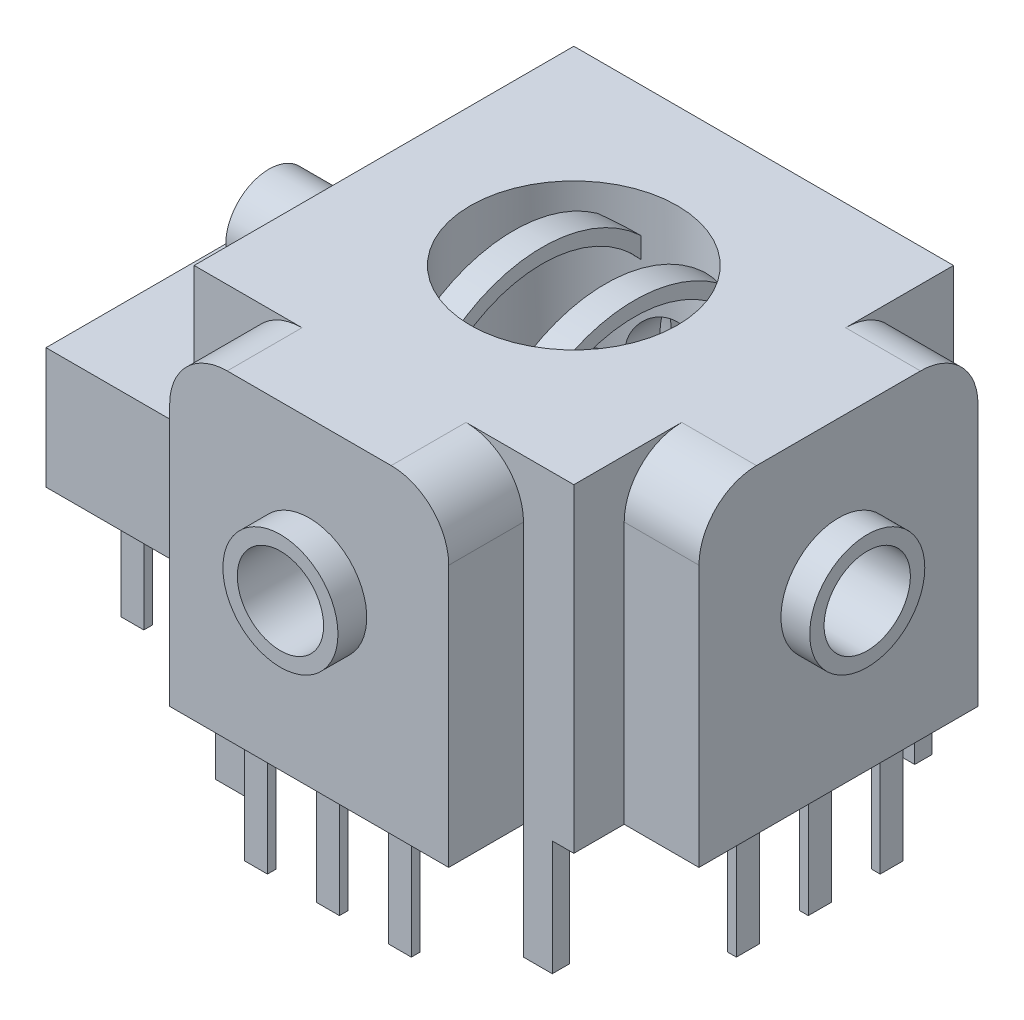
from build123d import *

# Parameters (mm, degrees)
SKETCH_1_W          = 13.2
SKETCH_1_H          = 13.2
SKETCH_1_W_2        = 2.6
SKETCH_1_H_2        = 9.7
SKETCH_1_W_3        = 9.7
SKETCH_1_H_3        = 2.6
EXTRUDE_1_DEPTH     = 11.1
SKETCH_1_7_W        = 7
SKETCH_1_7_H        = 9.5
EXTRUDE_2_DEPTH     = 4.2
SKETCH_1_8_R        = 1.75
EXTRUDE_3_DEPTH     = 5.2
SKETCH_2_R          = 1.5
EXTRUDE_4_DEPTH     = 4
SKETCH_1_9_W        = 1.4
SKETCH_1_9_H        = 1
EXTRUDE_5_DEPTH     = 1.8
SKETCH_3_R          = 2
SKETCH_3_R_2        = 1.5
EXTRUDE_6_DEPTH     = 1
CUT_EXTRUDE_START   = -10
SKETCH_3_3_R        = 1.5
CUT_EXTRUDE_1_DEPTH = 10
SKETCH_4_R          = 2
SKETCH_4_R_2        = 1.5
EXTRUDE_7_DEPTH     = 1
SKETCH_4_3_R        = 1.5
CUT_EXTRUDE_2_DEPTH = 25.298353854
CUT_EXTRUDE_START_2 = 11.1
SKETCH_1_10_R       = 3.6
CUT_EXTRUDE_3_DEPTH = 5
SKETCH_5_W          = 0.8
SKETCH_5_H          = 0.3
SKETCH_5_W_2        = 0.3
SKETCH_5_H_2        = 0.8
SKETCH_5_W_3        = 1
SKETCH_5_H_3        = 0.6
EXTRUDE_8_DEPTH     = 4
FILLET_1_R          = 2
EXTRUDE_START       = -8.1
EXTRUDE_1_2_DEPTH   = 1
EXTRUDE_START_2     = -11.3
EXTRUDE_2_2_DEPTH   = 1


# Read off the part's stored shape, not the designer's step: 拉伸-薄壁1, 拉伸-薄壁2
with BuildPart() as part:
    # 草图1 → Extrude 1 (new body)
    with BuildSketch(Plane(origin=(0, 0, 0), x_dir=(1, 0, 0), z_dir=(0, 1, 0))):
        Rectangle(SKETCH_1_W, SKETCH_1_H)
        with Locations((7.9, 0)):
            Rectangle(SKETCH_1_W_2, SKETCH_1_H_2)
        with Locations((0, -7.9)):
            Rectangle(SKETCH_1_W_3, SKETCH_1_H_3)
    extrude(amount=EXTRUDE_1_DEPTH)

    # 草图1<7> → Extrude 2 (add)
    with BuildSketch(Plane(origin=(0, 0, 0), x_dir=(1, 0, 0), z_dir=(0, 1, 0))):
        with Locations((-10.1, 0)):
            Rectangle(SKETCH_1_7_W, SKETCH_1_7_H)
    extrude(amount=EXTRUDE_2_DEPTH)

    # 草图1<8> → 凸台-拉伸3 (add)
    with BuildSketch(Plane(origin=(0, 0, 0), x_dir=(1, 0, 0), z_dir=(0, 1, 0))):
        with Locations(Location((-10.1, 0, 0), (0, 0, 270))):
            Circle(SKETCH_1_8_R)
    extrude(amount=EXTRUDE_3_DEPTH)

    # 草图2 → 凸台-拉伸4 (add)
    with BuildSketch(Plane.ZY.offset(6.6)):
        with Locations(Location((0, 7.2, 0), (0, 0, 180))):
            Circle(SKETCH_2_R)
    extrude(amount=EXTRUDE_4_DEPTH)

    # 草图1<9> → 凸台-拉伸5 (add)
    with BuildSketch(Plane(origin=(0, 0, 0), x_dir=(1, 0, 0), z_dir=(0, 1, 0))):
        with Locations((-4.15, 7.1)):
            Rectangle(SKETCH_1_9_W, SKETCH_1_9_H)
        with Locations((4.15, 7.1)):
            Rectangle(SKETCH_1_9_W, SKETCH_1_9_H)
    extrude(amount=EXTRUDE_5_DEPTH)

    # 草图3 → 凸台-拉伸6 (add)
    with BuildSketch(Plane(origin=(9.2, 0, 0), x_dir=(0, 0, -1), z_dir=(1, 0, 0))):
        with Locations((0, 6.1)):
            Circle(SKETCH_3_R)
        with Locations((0, 6.1)):
            Circle(SKETCH_3_R_2, mode=Mode.SUBTRACT)
    extrude(amount=EXTRUDE_6_DEPTH)

    # 草图3<3> → 切除-拉伸1 (cut)
    with BuildSketch(Plane(origin=(9.2, 0, 0), x_dir=(0, 0, -1), z_dir=(1, 0, 0)).offset(CUT_EXTRUDE_START)):
        with Locations((0, 6.1)):
            Circle(SKETCH_3_3_R)
    extrude(amount=CUT_EXTRUDE_1_DEPTH, mode=Mode.SUBTRACT)

    # 草图4 → 凸台-拉伸7 (add)
    with BuildSketch(Plane.XY.offset(9.2)):
        with Locations(Location((0, 6.1, 0), (0, 0, 180))):
            Circle(SKETCH_4_R)
        with Locations((0, 6.1)):
            Circle(SKETCH_4_R_2, mode=Mode.SUBTRACT)
    extrude(amount=EXTRUDE_7_DEPTH)

    # 草图4<3> → 切除-拉伸2 (cut, through all)
    with BuildSketch(Plane.XY.offset(9.2)):
        with Locations(Location((0, 6.1, 0), (0, 0, 180))):
            Circle(SKETCH_4_3_R)
    extrude(amount=-CUT_EXTRUDE_2_DEPTH, mode=Mode.SUBTRACT)

    # 草图1<10> → 切除-拉伸3 (cut)
    with BuildSketch(Plane(origin=(0, 0, 0), x_dir=(1, 0, 0), z_dir=(0, 1, 0)).offset(CUT_EXTRUDE_START_2)):
        with Locations(Location((0, 0, 0), (0, 0, 270))):
            Circle(SKETCH_1_10_R)
    extrude(amount=-CUT_EXTRUDE_3_DEPTH, mode=Mode.SUBTRACT)

    # 草图5 → 凸台-拉伸8 (add)
    with BuildSketch(Plane.XZ):
        with Locations((-2.5, 8.4)):
            Rectangle(SKETCH_5_W, SKETCH_5_H)
        with Locations((0, 8.4)):
            Rectangle(SKETCH_5_W, SKETCH_5_H)
        with Locations((2.5, 8.4)):
            Rectangle(SKETCH_5_W, SKETCH_5_H)
        with Locations((8.4, 2.5)):
            Rectangle(SKETCH_5_W_2, SKETCH_5_H_2)
        with Locations((8.4, 0)):
            Rectangle(SKETCH_5_W_2, SKETCH_5_H_2)
        with Locations((8.4, -2.5)):
            Rectangle(SKETCH_5_W_2, SKETCH_5_H_2)
        with Locations((-12, 3.2)):
            Rectangle(SKETCH_5_W, SKETCH_5_H)
        with Locations((-7.8, 3.2)):
            Rectangle(SKETCH_5_W, SKETCH_5_H)
        with Locations((-12, -3.2)):
            Rectangle(SKETCH_5_W, SKETCH_5_H)
        with Locations((-7.8, -3.2)):
            Rectangle(SKETCH_5_W, SKETCH_5_H)
        with Locations((5.35, 6.3)):
            Rectangle(SKETCH_5_W_3, SKETCH_5_H_3)
        with Locations((-5.35, 6.3)):
            Rectangle(SKETCH_5_W_3, SKETCH_5_H_3)
        with Locations((-5.35, -6.3)):
            Rectangle(SKETCH_5_W_3, SKETCH_5_H_3)
        with Locations((5.35, -6.3)):
            Rectangle(SKETCH_5_W_3, SKETCH_5_H_3)
    extrude(amount=EXTRUDE_8_DEPTH)

    # 圆角1
    fillet_1_edges = [part.edges().sort_by_distance(p)[0] for p in [
        (4.85, 11.1, 7.9),
        (-4.85, 11.1, 7.9),
        (7.9, 11.1, -4.85),
        (7.9, 11.1, 4.85),
    ]]
    fillet(fillet_1_edges, radius=FILLET_1_R)

    # Extrude 1 2 outline → Extrude 1 2 (add)
    with BuildSketch(Plane(origin=(9.2, 0, 0), x_dir=(0, 0, -1), z_dir=(1, 0, 0)).offset(EXTRUDE_START)):
        with BuildLine():
            Line((-4.135414557, 8.183540797), (-3.4278273, 9.015475947))
            ThreePointArc((-3.4278273, 9.015475947), (0, 10.6), (3.4278273, 9.015475947))
            Line((3.4278273, 9.015475947), (4.135414557, 8.183540797))
            Line((4.135414557, 8.183540797), (3.870172577, 9.32349991))
            Line((3.870172577, 9.32349991), (3.4278273, 9.740054945))
            ThreePointArc((3.4278273, 9.740054945), (0, 11.1), (-3.4278273, 9.740054945))
            Line((-3.4278273, 9.740054945), (-3.870172577, 9.32349991))
            Line((-3.870172577, 9.32349991), (-4.135414557, 8.183540797))
        make_face()
        with BuildLine():
            Line((-4.3829214, 7.119803903), (-4.135414557, 8.183540797))
            Line((-4.135414557, 8.183540797), (-4.847769521, 7.346000087))
            Line((-4.847769521, 7.346000087), (-4.8948953, 7.119803903))
            ThreePointArc((-4.8948953, 7.119803903), (-5, 6.1), (-4.8948953, 5.080196097))
            Line((-4.8948953, 5.080196097), (-4.669846932, 4))
            Line((-4.669846932, 4), (-4.131584884, 4))
            Line((-4.131584884, 4), (-4.3829214, 5.080196097))
            ThreePointArc((-4.3829214, 5.080196097), (-4.5, 6.1), (-4.3829214, 7.119803903))
        make_face()
        with BuildLine():
            Line((4.847769521, 7.346000087), (4.135414557, 8.183540797))
            Line((4.135414557, 8.183540797), (4.3829214, 7.119803903))
            ThreePointArc((4.3829214, 7.119803903), (4.5, 6.1), (4.3829214, 5.080196097))
            Line((4.3829214, 5.080196097), (4.131584884, 4))
            Line((4.131584884, 4), (4.669846932, 4))
            Line((4.669846932, 4), (4.8948953, 5.080196097))
            ThreePointArc((4.8948953, 5.080196097), (5, 6.1), (4.8948953, 7.119803903))
            Line((4.8948953, 7.119803903), (4.847769521, 7.346000087))
        make_face()
    extrude(amount=EXTRUDE_1_2_DEPTH)

    # Extrude 2 2 outline → Extrude 2 2 (add)
    with BuildSketch(Plane(origin=(9.2, 0, 0), x_dir=(0, 0, -1), z_dir=(1, 0, 0)).offset(EXTRUDE_START_2)):
        with BuildLine():
            Line((-4.135414557, 8.183540797), (-3.4278273, 9.015475947))
            ThreePointArc((-3.4278273, 9.015475947), (0, 10.6), (3.4278273, 9.015475947))
            Line((3.4278273, 9.015475947), (4.135414557, 8.183540797))
            Line((4.135414557, 8.183540797), (3.870172577, 9.32349991))
            Line((3.870172577, 9.32349991), (3.4278273, 9.740054945))
            ThreePointArc((3.4278273, 9.740054945), (0, 11.1), (-3.4278273, 9.740054945))
            Line((-3.4278273, 9.740054945), (-3.870172577, 9.32349991))
            Line((-3.870172577, 9.32349991), (-4.135414557, 8.183540797))
        make_face()
        with BuildLine():
            Line((-4.3829214, 7.119803903), (-4.135414557, 8.183540797))
            Line((-4.135414557, 8.183540797), (-4.847769521, 7.346000087))
            Line((-4.847769521, 7.346000087), (-4.8948953, 7.119803903))
            ThreePointArc((-4.8948953, 7.119803903), (-5, 6.1), (-4.8948953, 5.080196097))
            Line((-4.8948953, 5.080196097), (-4.669846932, 4))
            Line((-4.669846932, 4), (-4.131584884, 4))
            Line((-4.131584884, 4), (-4.3829214, 5.080196097))
            ThreePointArc((-4.3829214, 5.080196097), (-4.5, 6.1), (-4.3829214, 7.119803903))
        make_face()
        with BuildLine():
            Line((4.847769521, 7.346000087), (4.135414557, 8.183540797))
            Line((4.135414557, 8.183540797), (4.3829214, 7.119803903))
            ThreePointArc((4.3829214, 7.119803903), (4.5, 6.1), (4.3829214, 5.080196097))
            Line((4.3829214, 5.080196097), (4.131584884, 4))
            Line((4.131584884, 4), (4.669846932, 4))
            Line((4.669846932, 4), (4.8948953, 5.080196097))
            ThreePointArc((4.8948953, 5.080196097), (5, 6.1), (4.8948953, 7.119803903))
            Line((4.8948953, 7.119803903), (4.847769521, 7.346000087))
        make_face()
    extrude(amount=EXTRUDE_2_2_DEPTH)


solid = part.part
